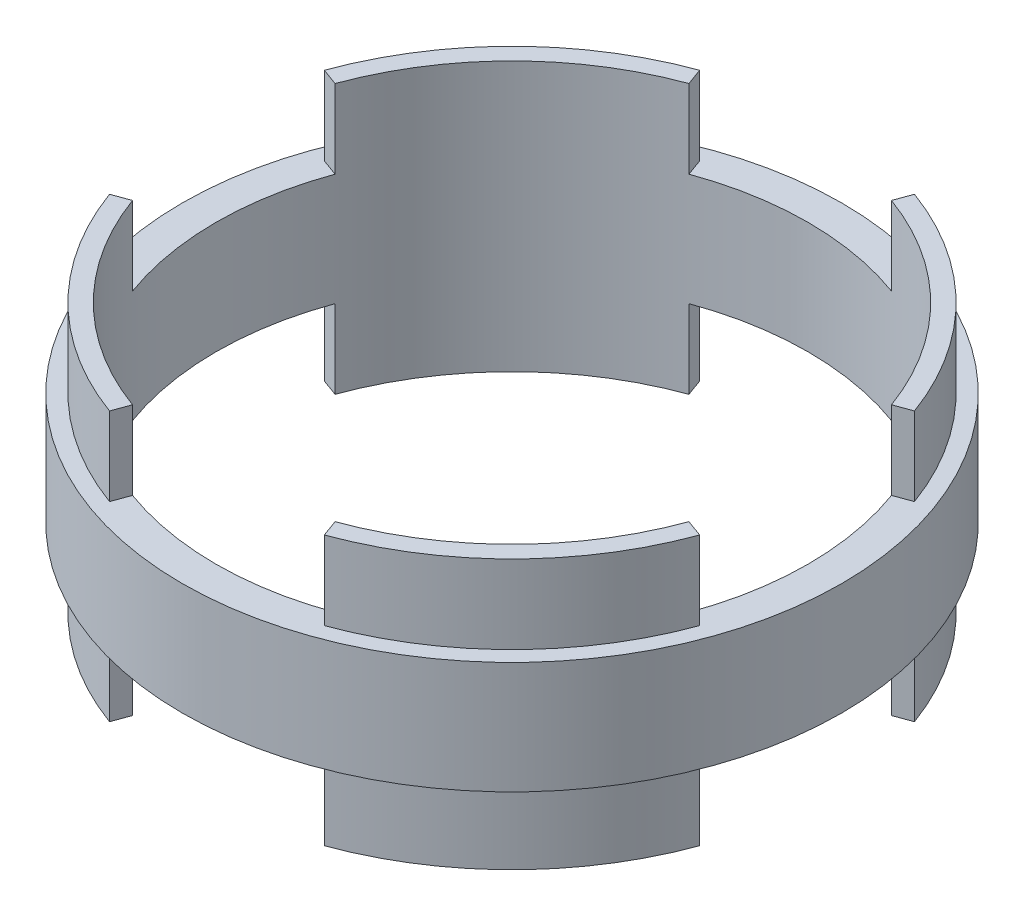
from build123d import *
from build123d.topology import SkipClean

# Parameters (mm, degrees)
SKETCH1_R           = 93.345
SKETCH1_R_2         = 83.82
BOSS_EXTRUDE1_DEPTH = 15.875
SKETCH2_R           = 88.9
SKETCH2_R_2         = 83.82
BOSS_EXTRUDE2_DEPTH = 38.1
CUT_EXTRUDE1_DEPTH  = 38.1
CIRPATTERN1_COUNT   = 4
SKETCH4_R           = 88.9
SKETCH4_R_2         = 83.82
BOSS_EXTRUDE3_DEPTH = 15.875


with BuildPart() as part:
    # Sketch1 → Boss-Extrude1 (new, symmetric)
    with BuildSketch(Plane(origin=(0, 0, 0), x_dir=(1, 0, 0), z_dir=(0, 1, 0))):
        Circle(SKETCH1_R)
        Circle(SKETCH1_R_2, mode=Mode.SUBTRACT)
    extrude(amount=BOSS_EXTRUDE1_DEPTH, both=True)

    # Sketch2 → Boss-Extrude2 (add, symmetric)
    with BuildSketch(Plane(origin=(0, 0, 0), x_dir=(1, 0, 0), z_dir=(0, 1, 0))):
        Circle(SKETCH2_R)
        Circle(SKETCH2_R_2, mode=Mode.SUBTRACT)
    extrude(amount=BOSS_EXTRUDE2_DEPTH, both=True)

    # Sketch3 → Cut-Extrude1 (cut, symmetric)
    with BuildSketch(Plane(origin=(0, 0, 0), x_dir=(1, 0, 0), z_dir=(0, 1, 0))):
        with BuildLine():
            Line((0, 0), (-30.405590742, 83.538673988))
            ThreePointArc((-30.405590742, 83.538673988), (0, 88.9), (30.405590742, 83.538673988))
            Line((30.405590742, 83.538673988), (0, 0))
        make_face()
    cut_extrude1 = extrude(amount=CUT_EXTRUDE1_DEPTH, both=True, mode=Mode.SUBTRACT)

    # CirPattern1: Cut-Extrude1 ×4 about axis
    cirpattern1_axis = Axis((0, 38.1, 0), (0, -1, 0))
    for i in range(1, CIRPATTERN1_COUNT):
        add(cut_extrude1.rotate(cirpattern1_axis, i * 360 / CIRPATTERN1_COUNT), mode=Mode.SUBTRACT)

    # Sketch4 → Boss-Extrude3 (add, symmetric)
    with SkipClean():  # the faces are left unmerged after this step: merging them gives an invalid solid
        with BuildSketch(Plane(origin=(0, 0, 0), x_dir=(1, 0, 0), z_dir=(0, 1, 0))):
            Circle(SKETCH4_R)
            Circle(SKETCH4_R_2, mode=Mode.SUBTRACT)
        extrude(amount=BOSS_EXTRUDE3_DEPTH, both=True)


solid = part.part
